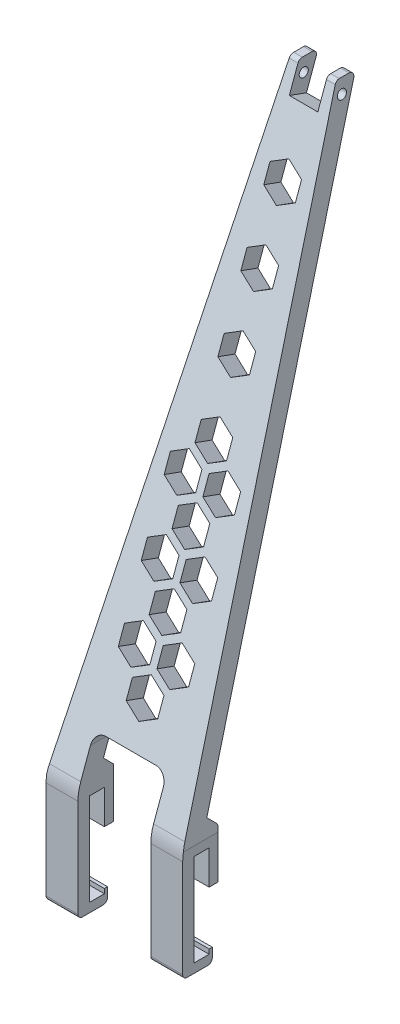
from build123d import *

# Parameters (mm, degrees)
BOSS_EXTRUDE1_DEPTH     = 30
CUT_EXTRUDE1_DEPTH      = 197.169807399
SKETCH4_W               = 32
SKETCH4_H               = 68.5
CUT_EXTRUDE2_DEPTH      = 197.169807399
CHAMFER1_SIZE           = 7.802060087
CHAMFER1_SIZE_2         = 10
CUT_EXTRUDE3_DEPTH      = 163.649773439
CUT_EXTRUDE4_DEPTH      = 181.083572192
CUT_EXTRUDE4_DEPTH_BACK = 181.083572192
SKETCH6_R               = 2
FILL_PATTERN1_DEPTH     = 8
FILLET5_R               = 20
FILLET2_R               = 5
FILLET4_R               = 2
FILLET6_R               = 2


# Read off the part's stored shape, not the designer's step: Fill Pattern1
with BuildPart() as part:
    # Sketch2 → Boss-Extrude1 (new, symmetric)
    with BuildSketch(Plane(origin=(0, 0, 0), x_dir=(0, 0, -1), z_dir=(1, 0, 0))):
        Polygon((35.163005932, 120), (-52.189850292, -120), (-52.189850292, -168.5), (-39.189850292, -168.5), (-39.189850292, -162.5), (-40.589850292, -162.5), (-40.589850292, -164.5), (-47.189850292, -164.5), (-47.189850292, -124), (-40.589850292, -124), (-40.589850292, -139), (-36.589850292, -139), (-36.589850292, -120), (-43.676428112, -120), (43.676428112, 120), align=None)
    extrude(amount=BOSS_EXTRUDE1_DEPTH, both=True)

    # Sketch3 → Cut-Extrude1 (cut, through all)
    with BuildSketch(Plane.XY.offset(52.189850292)):
        Polygon((-30, 120), (-30, -120), (-10, 120), align=None)
        Polygon((10, 120), (30, 120), (30, -120), align=None)
    extrude(amount=-CUT_EXTRUDE1_DEPTH, mode=Mode.SUBTRACT)

    # Sketch4 → Cut-Extrude2 (cut, through all)
    with BuildSketch(Plane.XY.offset(52.189850292)):
        with Locations((0, -134.25)):
            Rectangle(SKETCH4_W, SKETCH4_H)
    extrude(amount=-CUT_EXTRUDE2_DEPTH, mode=Mode.SUBTRACT)

    # Chamfer1
    # the kernel refuses this chamfer: 10, 7.802060087 mm, written as the material it adds along each edge
    with BuildSketch(Plane(origin=(-16, -120, 43.676428112), x_dir=(0, 0.9542611885293295, -0.29897421973573485), z_dir=(-1, 0, 0))) as chamfer1_piece_1_section:
        Polygon((CHAMFER1_SIZE * 0.998967402661, CHAMFER1_SIZE * 0.0454326803806), (CHAMFER1_SIZE_2 * 0.298974219736, CHAMFER1_SIZE_2 * 0.954261188529), (0, 0), align=None)
    chamfer1_piece_1 = extrude(amount=14, mode=Mode.PRIVATE)
    chamfer1_piece_1 = split(chamfer1_piece_1, bisect_by=Plane(origin=(-29.733836006, -116.806032072, 40.079574986), z_dir=(0.9965457582448797, -0.08304547985373997, 0)), keep=Keep.TOP, mode=Mode.PRIVATE)
    chamfer1_piece_1 = split(chamfer1_piece_1, bisect_by=Plane(origin=(-22.890520375, -117.376308375, 36.589850292), z_dir=(0, 0, 1)), keep=Keep.TOP, mode=Mode.PRIVATE)
    add(chamfer1_piece_1)
    with BuildSketch(Plane(origin=(30, -120, 43.676428112), x_dir=(0, 0.9542611885293295, -0.29897421973573485), z_dir=(-1, 0, 0))) as chamfer1_piece_2_section:
        Polygon((CHAMFER1_SIZE * 0.998967402661, CHAMFER1_SIZE * 0.0454326803806), (CHAMFER1_SIZE_2 * 0.298974219736, CHAMFER1_SIZE_2 * 0.954261188529), (0, 0), align=None)
    chamfer1_piece_2 = extrude(amount=14, mode=Mode.PRIVATE)
    chamfer1_piece_2 = split(chamfer1_piece_2, bisect_by=Plane(origin=(29.733836006, -116.806032072, 40.079574986), z_dir=(-0.9965457582448797, -0.08304547985373997, 0)), keep=Keep.TOP, mode=Mode.PRIVATE)
    chamfer1_piece_2 = split(chamfer1_piece_2, bisect_by=Plane(origin=(22.890520375, -117.376308375, 36.589850292), z_dir=(0, 0, 1)), keep=Keep.TOP, mode=Mode.PRIVATE)
    add(chamfer1_piece_2)

    # Sketch5 → Cut-Extrude3 (cut, through all)
    with BuildSketch(Plane(origin=(0, -20.133671251, 15.841479222), x_dir=(1, 0, 0), z_dir=(0, 0.3420201433256661, 0.9396926207859094))):
        Polygon((6.25, 149.12713812), (6.25, 136.62713812), (-6.25, 136.62713812), (-6.25, 149.12713812), (-6.25, 152.038899995), (6.25, 152.038899995), align=None)
    extrude(amount=-CUT_EXTRUDE3_DEPTH, mode=Mode.SUBTRACT)

    # Sketch6 → Cut-Extrude4 (cut, two sides: drawn at the far end of the back side and taken through both)
    with BuildSketch(Plane.ZY.offset(-6.25).offset(-CUT_EXTRUDE4_DEPTH_BACK)):
        with Locations(Location((-37.211675699, 113.933456323, 0), (0, 0, 270))):
            Circle(SKETCH6_R)
    extrude(amount=CUT_EXTRUDE4_DEPTH + CUT_EXTRUDE4_DEPTH_BACK, mode=Mode.SUBTRACT)

    # Fill Pattern1 outline → Fill Pattern1 (cut)
    with BuildSketch(Plane(origin=(0, 0, 0), x_dir=(1, 0, 0), z_dir=(0, 0.34202014332566616, 0.9396926207859093))):
        Polygon((8.5, -84.523921196), (15.42820323, -80.523921196), (15.42820323, -72.523921196), (8.5, -68.523921196), (1.57179677, -72.523921196), (1.57179677, -80.523921196), align=None)
        Polygon((15.42820323, -51.079057467), (15.42820323, -43.079057467), (8.5, -39.079057467), (1.57179677, -43.079057467), (1.57179677, -51.079057467), (8.5, -55.079057467), align=None)
        Polygon((15.42820323, -21.634193738), (15.42820323, -13.634193738), (8.5, -9.634193738), (1.57179677, -13.634193738), (1.57179677, -21.634193738), (8.5, -25.634193738), align=None)
        Polygon((-8.5, -25.634193738), (-1.57179677, -21.634193738), (-1.57179677, -13.634193738), (-8.5, -9.634193738), (-15.42820323, -13.634193738), (-15.42820323, -21.634193738), align=None)
        Polygon((-1.57179677, -51.079057467), (-1.57179677, -43.079057467), (-8.5, -39.079057467), (-15.42820323, -43.079057467), (-15.42820323, -51.079057467), (-8.5, -55.079057467), align=None)
        Polygon((-1.57179677, -80.523921196), (-1.57179677, -72.523921196), (-8.5, -68.523921196), (-15.42820323, -72.523921196), (-15.42820323, -80.523921196), (-8.5, -84.523921196), align=None)
        Polygon((0, -40.356625603), (6.92820323, -36.356625603), (6.92820323, -28.356625603), (0, -24.356625603), (-6.92820323, -28.356625603), (-6.92820323, -36.356625603), align=None)
        Polygon((6.92820323, -6.911761874), (6.92820323, 1.088238126), (0, 5.088238126), (-6.92820323, 1.088238126), (-6.92820323, -6.911761874), (0, -10.911761874), align=None)
        Polygon((6.92820323, 22.533101855), (6.92820323, 30.533101855), (0, 34.533101855), (-6.92820323, 30.533101855), (-6.92820323, 22.533101855), (0, 18.533101855), align=None)
        Polygon((6.92820323, 81.422829312), (6.92820323, 89.422829312), (0, 93.422829312), (-6.92820323, 89.422829312), (-6.92820323, 81.422829312), (0, 77.422829312), align=None)
        Polygon((6.92820323, 51.977965583), (6.92820323, 59.977965583), (0, 63.977965583), (-6.92820323, 59.977965583), (-6.92820323, 51.977965583), (0, 47.977965583), align=None)
        Polygon((6.92820323, -65.801489331), (6.92820323, -57.801489331), (0, -53.801489331), (-6.92820323, -57.801489331), (-6.92820323, -65.801489331), (0, -69.801489331), align=None)
        Polygon((6.92820323, -95.24635306), (6.92820323, -87.24635306), (0, -83.24635306), (-6.92820323, -87.24635306), (-6.92820323, -95.24635306), (0, -99.24635306), align=None)
    extrude(amount=FILL_PATTERN1_DEPTH, mode=Mode.SUBTRACT)

    # Fillet5
    fillet5_edges = [part.edges().sort_by_distance(p)[0] for p in [
        (23, -120, 52.189850292),
        (-23, -120, 52.189850292),
    ]]
    fillet(fillet5_edges, radius=FILLET5_R)

    # Fillet2
    fillet2_edges = [part.edges().sort_by_distance(p)[0] for p in [
        (-16, -100, 40.653734517),
        (16, -100, 40.653734517),
    ]]
    fillet(fillet2_edges, radius=FILLET2_R)

    # Fillet4
    fillet4_edges = [part.edges().sort_by_distance(p)[0] for p in [
        (-8.125, 120, -43.676428112),
        (-8.125, 120, -35.163005932),
        (8.125, 120, -43.676428112),
        (8.125, 120, -35.163005932),
    ]]
    fillet(fillet4_edges, radius=FILLET4_R)

    # Fillet6
    fillet6_edges = [part.edges().sort_by_distance(p)[0] for p in [
        (23, -168.5, 39.189850292),
        (23, -168.5, 52.189850292),
        (-23, -168.5, 39.189850292),
        (-23, -168.5, 52.189850292),
    ]]
    fillet(fillet6_edges, radius=FILLET6_R)


solid = part.part
